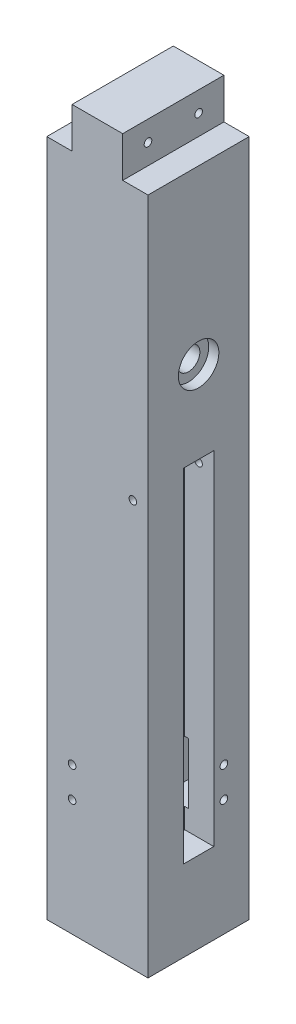
from build123d import *

# Parameters (mm, degrees)
BOSS_EXTRUDE1_DEPTH = 127
SKETCH2_R           = 14.2875
SKETCH2_R_2         = 4.7625
CUT_EXTRUDE1_DEPTH  = 509.991220455
SKETCH3_W           = 31.75
SKETCH3_H           = 76.2
CUT_EXTRUDE2_DEPTH  = 63.5
SKETCH2_3_R         = 25.4
SKETCH2_3_R_2       = 14.2875
CUT_EXTRUDE3_DEPTH  = 12.7
SKETCH4_R           = 4.7625
CUT_EXTRUDE4_DEPTH  = 69.85
SKETCH5_W           = 31.75
SKETCH5_H           = 76.2
CUT_EXTRUDE6_DEPTH  = 63.246
SKETCH6_R           = 4.7625
CUT_EXTRUDE7_DEPTH  = 69.85
SKETCH7_W           = 38.1
SKETCH7_H           = 430.2125
CUT_EXTRUDE8_DEPTH  = 36.5125
SKETCH8_R           = 4.7625
CUT_EXTRUDE9_DEPTH  = 497.966107999


with BuildPart() as part:
    # Sketch1 → Boss-Extrude1 (new body)
    with BuildSketch(Plane.XY):
        Polygon((63.5, -425.45), (63.5, 425.45), (31.75, 425.45), (31.75, 476.25), (-31.75, 476.25), (-31.75, 425.45), (-63.5, 425.45), (-63.5, -425.45), align=None)
    extrude(amount=BOSS_EXTRUDE1_DEPTH)

    # Sketch2 → Cut-Extrude1 (cut, through all)
    with BuildSketch(Plane(origin=(63.5, 0, 0), x_dir=(0, 0, -1), z_dir=(1, 0, 0))):
        with Locations((-63.5, 209.55)):
            Circle(SKETCH2_R)
        with Locations((-95.25, 450.85)):
            Circle(SKETCH2_R_2)
        with Locations((-31.75, 450.85)):
            Circle(SKETCH2_R_2)
    extrude(amount=-CUT_EXTRUDE1_DEPTH, mode=Mode.SUBTRACT)

    # Sketch3 → Cut-Extrude2 (cut)
    with BuildSketch(Plane(origin=(0, 0, 0), x_dir=(-1, 0, 0), z_dir=(0, 0, -1))):
        with Locations((-15.875, -260.35)):
            Rectangle(SKETCH3_W, SKETCH3_H)
    extrude(amount=-CUT_EXTRUDE2_DEPTH, mode=Mode.SUBTRACT)

    # Sketch2<3> → Cut-Extrude3 (cut)
    with BuildSketch(Plane(origin=(63.5, 0, 0), x_dir=(0, 0, -1), z_dir=(1, 0, 0))):
        with Locations((-63.5, 209.55)):
            Circle(SKETCH2_3_R)
        with Locations((-63.5, 209.55)):
            Circle(SKETCH2_3_R_2, mode=Mode.SUBTRACT)
    extrude(amount=-CUT_EXTRUDE3_DEPTH, mode=Mode.SUBTRACT)

    # Sketch4 → Cut-Extrude4 (cut)
    with BuildSketch(Plane(origin=(63.5, 0, 0), x_dir=(0, 0, -1), z_dir=(1, 0, 0))):
        with Locations((-31.75, -241.3)):
            Circle(SKETCH4_R)
        with Locations((-31.75, -279.4)):
            Circle(SKETCH4_R)
    extrude(amount=-CUT_EXTRUDE4_DEPTH, mode=Mode.SUBTRACT)

    # Sketch5 → Cut-Extrude6 (cut)
    with BuildSketch(Plane.ZY.offset(63.5)):
        with Locations((79.375, -260.35)):
            Rectangle(SKETCH5_W, SKETCH5_H)
    extrude(amount=-CUT_EXTRUDE6_DEPTH, mode=Mode.SUBTRACT)

    # Sketch6 → Cut-Extrude7 (cut)
    with BuildSketch(Plane.XY.offset(127)):
        with Locations((-31.75, -241.3)):
            Circle(SKETCH6_R)
        with Locations((-31.75, -279.4)):
            Circle(SKETCH6_R)
    extrude(amount=-CUT_EXTRUDE7_DEPTH, mode=Mode.SUBTRACT)

    # Sketch7 → Cut-Extrude8 (cut)
    with BuildSketch(Plane(origin=(63.5, 0, 0), x_dir=(0, 0, -1), z_dir=(1, 0, 0))):
        with Locations((-63.5, -108.74375)):
            Rectangle(SKETCH7_W, SKETCH7_H)
    extrude(amount=-CUT_EXTRUDE8_DEPTH, mode=Mode.SUBTRACT)

    # Sketch8 → Cut-Extrude9 (cut, through all)
    with BuildSketch(Plane(origin=(0, 0, 0), x_dir=(-1, 0, 0), z_dir=(0, 0, -1))):
        with Locations((-44.45, 84.1375)):
            Circle(SKETCH8_R)
    extrude(amount=-CUT_EXTRUDE9_DEPTH, mode=Mode.SUBTRACT)


solid = part.part
